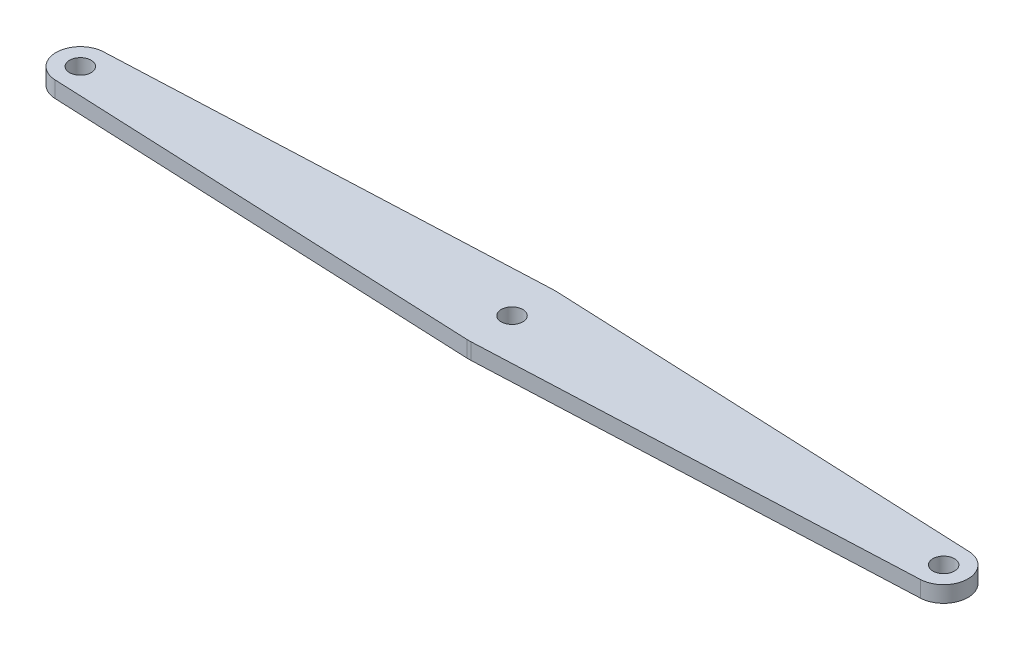
from build123d import *

# Parameters (mm, degrees)
EXTRUDE_449_DEPTH     = 3
SKETCH_2_R            = 2
CUT_EXTRUDE_660_DEPTH = 85.930133051
SKETCH_3_R            = 2
CUT_EXTRUDE_886_DEPTH = 85.930133051


with BuildPart() as part:
    # Эскиз1 → Extrude 449 (new body)
    with BuildSketch(Plane(origin=(0, 0, 0), x_dir=(1, 0, 0), z_dir=(0, 1, 0))):
        with BuildLine():
            Line((-80.196875, 4.495691297), (-0.35, 7.992340083))
            Line((-0.35, 7.992340083), (0.35, 7.992340083))
            Line((0.35, 7.992340083), (80.196875, 4.495691297))
            ThreePointArc((80.196875, 4.495691297), (84.5, 0), (80.196875, -4.495691297))
            Line((80.196875, -4.495691297), (0.35, -7.992340083))
            Line((0.35, -7.992340083), (-0.35, -7.992340083))
            Line((-0.35, -7.992340083), (-80.196875, -4.495691297))
            ThreePointArc((-80.196875, -4.495691297), (-84.5, 0), (-80.196875, 4.495691297))
        make_face()
    extrude(amount=EXTRUDE_449_DEPTH)

    # Эскиз2 → Cut-Extrude 660 (cut, through all)
    with BuildSketch(Plane(origin=(0, 3, 0), x_dir=(1, 0, 0), z_dir=(0, 1, 0))):
        Circle(SKETCH_2_R)
    extrude(amount=-CUT_EXTRUDE_660_DEPTH, mode=Mode.SUBTRACT)

    # Эскиз3 → Cut-Extrude 886 (cut, through all)
    with BuildSketch(Plane(origin=(0, 3, 0), x_dir=(1, 0, 0), z_dir=(0, 1, 0))):
        with Locations((-80, 0)):
            Circle(SKETCH_3_R)
        with Locations((80, 0)):
            Circle(SKETCH_3_R)
    extrude(amount=-CUT_EXTRUDE_886_DEPTH, mode=Mode.SUBTRACT)


solid = part.part
